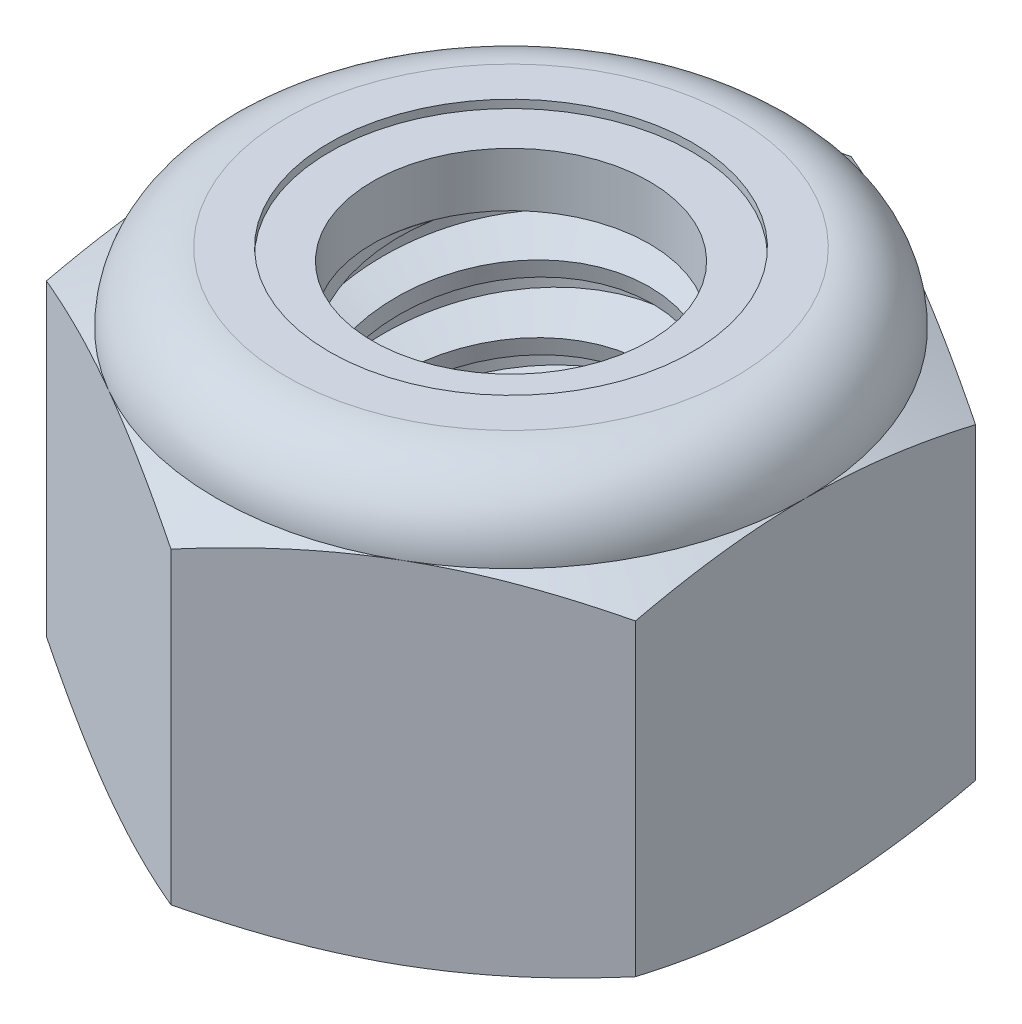
from build123d import *

# Parameters (mm, degrees)
EXTRUDE1_DEPTH       = 7.9375
SKETCH2_W            = 3.175
SKETCH2_H            = 7.9375
LPATTERN1_COUNT      = 6
LPATTERN1_PITCH      = 1.27
LPATTERN1_COUNT_DIR2 = 2
LPATTERN1_PITCH_DIR2 = 1.27


with BuildPart() as part:
    # Sketch1 → Extrude1 (new body)
    with BuildSketch(Plane(origin=(0, 0, 0), x_dir=(1, 0, 0), z_dir=(0, 1, 0))):
        Polygon((0, 6.415804866), (-5.55625, 3.207902433), (-5.55625, -3.207902433), (0, -6.415804866), (5.55625, -3.207902433), (5.55625, 3.207902433), align=None)
    extrude(amount=EXTRUDE1_DEPTH)

    # Sketch4 → Cut-Revolve2 (revolve, cut)
    with BuildSketch(Plane(origin=(0, 0, 0), x_dir=(0, 0, -1), z_dir=(1, 0, 0))):
        Polygon((0, 7.9375), (3.175, 7.9375), (2.609908356, 7.673993439), (2.609908356, 0.263506561), (3.175, 0), (0, 0), align=None)
    revolve(axis=Axis((0, 7.9375, 0), (0, 1, 0)), mode=Mode.SUBTRACT)


with BuildPart() as body_2:
    # Sketch2 → Revolve1 (revolve)
    with BuildSketch(Plane(origin=(0, 0, 0), x_dir=(0, 0, -1), z_dir=(1, 0, 0))):
        with Locations((1.5875, 3.96875)):
            Rectangle(SKETCH2_W, SKETCH2_H)
    revolve(axis=Axis((0, -3.175, 0), (0, 1, 0)))

    # Sketch3 → Cut-Revolve1 (revolve, cut)
    with BuildSketch(Plane(origin=(0, 0, 0), x_dir=(0, 0, -1), z_dir=(1, 0, 0))):
        Polygon((3.206133436, 7.781832818), (3.424067492, 6.692162542), (2.672175229, 6.946518763), (2.609908356, 7.257853128), align=None)
    cut_revolve1 = revolve(axis=Axis((0, 7.9375, 0.272704483), (0, -0.9805806756909201, -0.19611613513818427)), mode=Mode.SUBTRACT)

    # LPattern1: Cut-Revolve1 6 × 2
    with Locations(*[Vector(0, -1, 0) * (i * LPATTERN1_PITCH) + Vector(0, 1, 0) * (j * LPATTERN1_PITCH_DIR2) for i in range(LPATTERN1_COUNT) for j in range(LPATTERN1_COUNT_DIR2) if (i, j) != (0, 0)]):
        add(cut_revolve1, mode=Mode.SUBTRACT)


with BuildPart() as part_1:
    add(part.part)

    # Combine1: cut body 2
    add(body_2.part, mode=Mode.SUBTRACT)

    # Sketch5 → Cut-Revolve3 (revolve, cut)
    with BuildSketch(Plane(origin=(0, 0, 0), x_dir=(0, 0, -1), z_dir=(1, 0, 0))):
        with BuildLine():
            Line((0, 0), (5.55625, 0))
            Line((5.55625, 0), (6.415804866, 0.400817017))
            Line((6.415804866, 0.400817017), (6.415804866, 6.213766317))
            Line((6.415804866, 6.213766317), (5.55625, 6.614583333))
            ThreePointArc((5.55625, 6.614583333), (5.168776679, 7.550026679), (4.233333333, 7.9375))
            Line((4.233333333, 7.9375), (4.233333333, 9.2075))
            Line((4.233333333, 9.2075), (7.685804866, 9.2075))
            Line((7.685804866, 9.2075), (7.685804866, -1.27))
            Line((7.685804866, -1.27), (0, -1.27))
            Line((0, -1.27), (0, 0))
        make_face()
    revolve(axis=Axis((0, 0, 0), (0, 1, 0)), mode=Mode.SUBTRACT)

    # Sketch6 → Cut-Revolve4 (revolve, cut)
    with BuildSketch(Plane(origin=(0, 0, 0), x_dir=(0, 0, -1), z_dir=(1, 0, 0))):
        with BuildLine():
            Line((0, 6.614583333), (5.40385, 6.614583333))
            ThreePointArc((5.40385, 6.614583333), (5.061013606, 7.442263606), (4.233333333, 7.7851))
            Line((4.233333333, 7.7851), (3.421620845, 7.7851))
            Line((3.421620845, 7.7851), (3.421620845, 9.2075))
            Line((3.421620845, 9.2075), (0, 9.2075))
            Line((0, 9.2075), (0, 6.614583333))
        make_face()
    revolve(axis=Axis((0, 9.2075, 0), (0, 1, 0)), mode=Mode.SUBTRACT)


with BuildPart() as body_2_2:
    # Sketch7 → Revolve2 (revolve)
    with BuildSketch(Plane(origin=(0, 0, 0), x_dir=(0, 0, -1), z_dir=(1, 0, 0))):
        with BuildLine():
            Line((2.609908356, 6.690783333), (5.324993778, 6.690783333))
            ThreePointArc((5.324993778, 6.690783333), (4.979705237, 7.4148695), (4.233333333, 7.7089))
            Line((4.233333333, 7.7089), (2.609908356, 7.7089))
            Line((2.609908356, 7.7089), (2.609908356, 6.690783333))
        make_face()
    revolve(axis=Axis((0, 6.690783333, 0), (0, 1, 0)))


solid = Compound([part_1.part, body_2_2.part])
